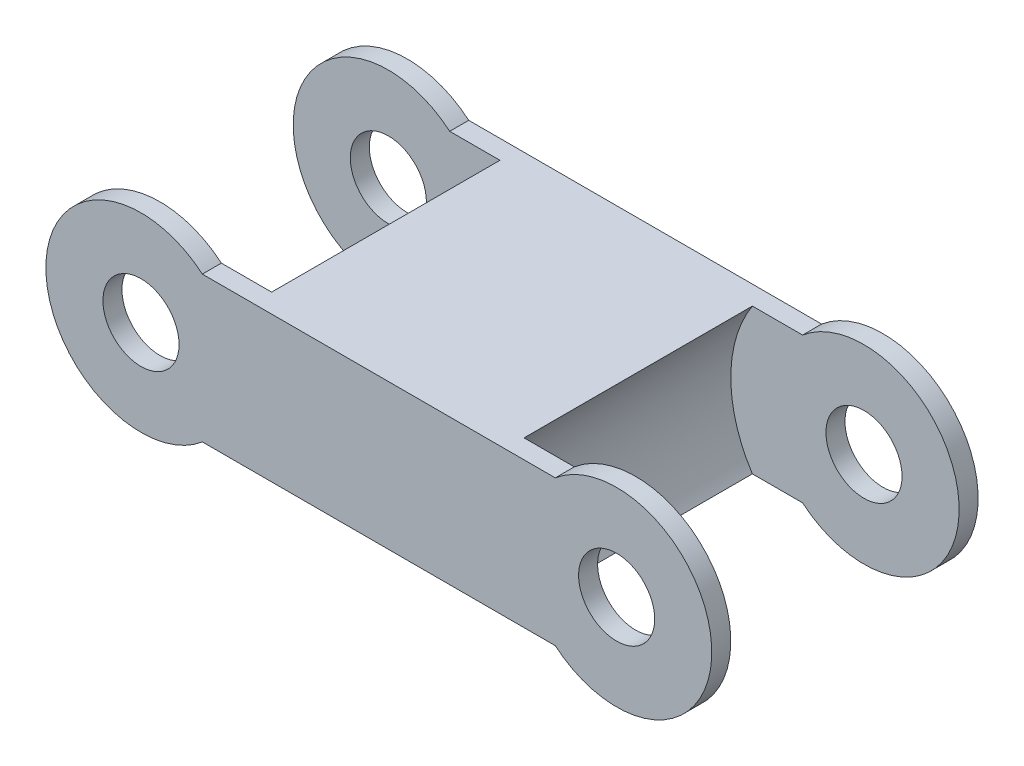
from build123d import *

# Parameters (mm, degrees)
BOSS_EXTRUDE1_DEPTH         = 14
BOSS_EXTRUDE1_DEPTH_BACK    = 14
SKETCH1_R                   = 4
CUT_EXTRUDE_THIN9_START     = -12
CUT_EXTRUDE_THIN9_OUTLINE_R = 4
CUT_EXTRUDE_THIN9_DEPTH     = 24


# Read off the part's stored shape, not the designer's step: Cut-Extrude-Thin9
with BuildPart() as part:
    # Sketch1 → Boss-Extrude1 (new, two sides: drawn at the far end of the back side and taken through both)
    with BuildSketch(Plane.XY.offset(-BOSS_EXTRUDE1_DEPTH_BACK)):
        with BuildLine():
            ThreePointArc((-17.839605582, 6.651694239), (-34.292375842, -0.987792391), (-17.839605582, -8.627279021))
            Line((-17.839605582, -8.627279021), (19.254853898, -8.627279021))
            ThreePointArc((19.254853898, -8.627279021), (35.707624158, -0.987792391), (19.254853898, 6.651694239))
            Line((19.254853898, 6.651694239), (-17.839605582, 6.651694239))
        make_face()
        with Locations((-24.292375842, -0.987792391)):
            Circle(SKETCH1_R, mode=Mode.SUBTRACT)
        with Locations((25.707624158, -0.987792391)):
            Circle(SKETCH1_R, mode=Mode.SUBTRACT)
    extrude(amount=BOSS_EXTRUDE1_DEPTH + BOSS_EXTRUDE1_DEPTH_BACK)

    # Cut-Extrude-Thin9 outline → Cut-Extrude-Thin9 (cut)
    # profile 1 of 2: a face of its own
    with BuildSketch(Plane.XY.offset(CUT_EXTRUDE_THIN9_START)):
        with BuildLine():
            ThreePointArc((13.975691494, 6.651694239), (11.707624158, -0.987792391), (13.975691494, -8.627279021))
            Line((13.975691494, -8.627279021), (19.254853898, -8.627279021))
            ThreePointArc((19.254853898, -8.627279021), (35.707624158, -0.987792391), (19.254853898, 6.651694239))
            Line((19.254853898, 6.651694239), (13.975691494, 6.651694239))
        make_face()
        with Locations((25.707624158, -0.987792391)):
            Circle(CUT_EXTRUDE_THIN9_OUTLINE_R, mode=Mode.SUBTRACT)
    # profile 2 of 2: a face of its own
    with BuildSketch(Plane.XY.offset(CUT_EXTRUDE_THIN9_START)):
        with BuildLine():
            Line((-17.839605582, -8.627279021), (-12.560443178, -8.627279021))
            ThreePointArc((-12.560443178, -8.627279021), (-10.292375842, -0.987792391), (-12.560443178, 6.651694239))
            Line((-12.560443178, 6.651694239), (-17.839605582, 6.651694239))
            ThreePointArc((-17.839605582, 6.651694239), (-34.292375842, -0.987792391), (-17.839605582, -8.627279021))
        make_face()
        with Locations((-24.292375842, -0.987792391)):
            Circle(CUT_EXTRUDE_THIN9_OUTLINE_R, mode=Mode.SUBTRACT)
    extrude(amount=CUT_EXTRUDE_THIN9_DEPTH, mode=Mode.SUBTRACT)


solid = part.part
